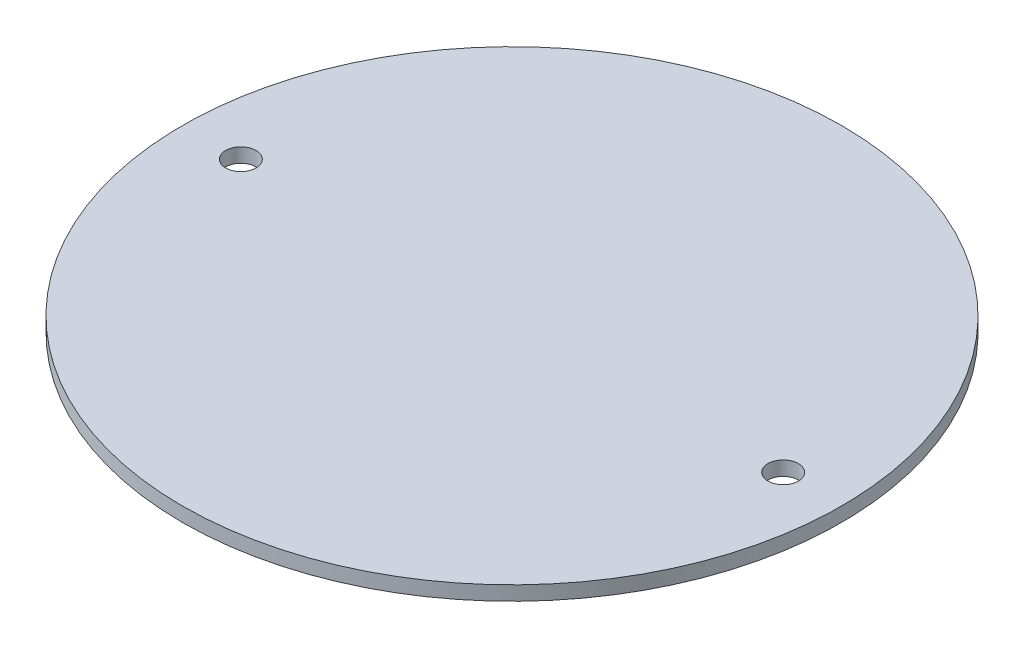
from build123d import *

# Parameters (mm, degrees)
SKETCH2_R               = 73.3171
BOSS_EXTRUDE1_DEPTH     = 3.175
F_1_4_CLEARANCE_HOLE1_D = 6.7564


with BuildPart() as part:
    # Sketch2 → Boss-Extrude1 (new body)
    with BuildSketch(Plane(origin=(0, 0, 0), x_dir=(1, 0, 0), z_dir=(0, 1, 0))):
        Circle(SKETCH2_R)
    extrude(amount=BOSS_EXTRUDE1_DEPTH)

    # 1/4 Clearance Hole1 (through all)
    with Locations(Plane(origin=(0, 3.175, 0), x_dir=(1, 0, 0), z_dir=(0, 1, 0))):
        with Locations((-60.325, 0), (60.325, 0)):
            Hole(F_1_4_CLEARANCE_HOLE1_D / 2)


solid = part.part
